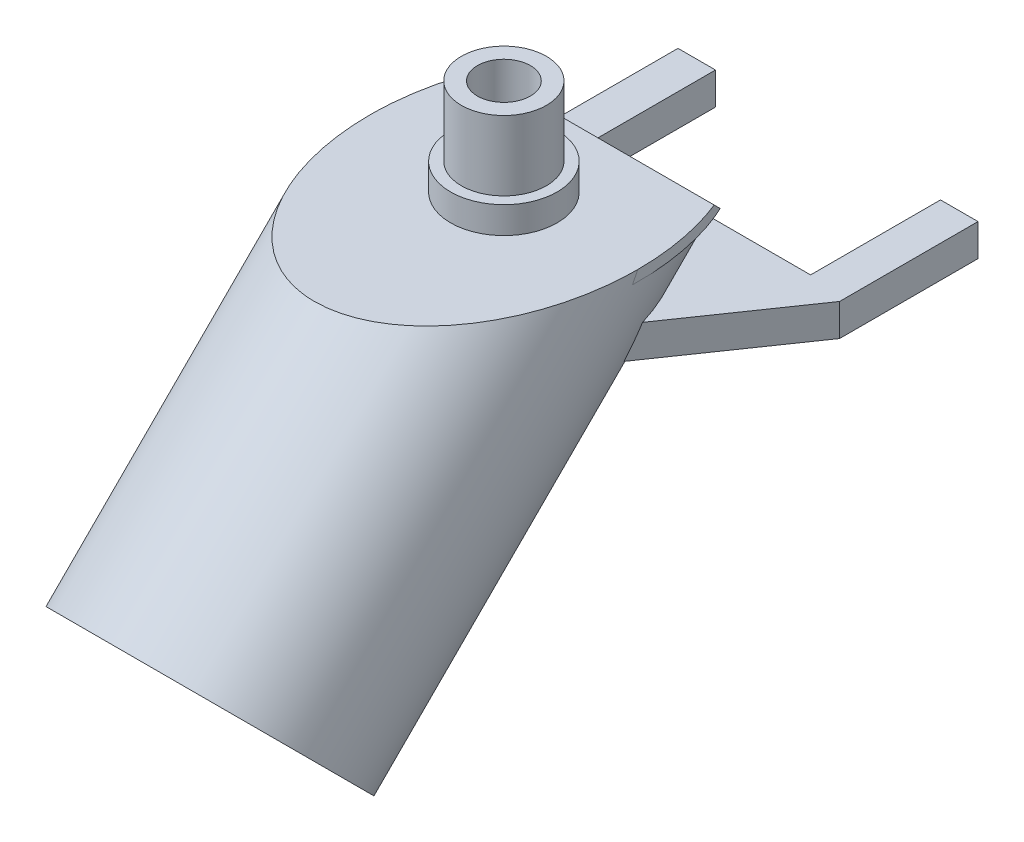
from build123d import *

# Parameters (mm, degrees)
SKETCH1_R                 = 9.94
SKETCH1_R_2               = 7.94
BOSS_EXTRUDE3_DEPTH       = 5
SKETCH1_6_R               = 7.94
SKETCH1_6_R_2             = 4.94
BOSS_EXTRUDE4_DEPTH       = 18
BOSS_EXTRUDE7_DEPTH       = 40
BOSS_EXTRUDE7_DEPTH_BACK  = 70
SKETCH4_R                 = 25
SKETCH4_R_2               = 23
SKETCH7_W                 = 197.712308018
SKETCH7_H                 = 113.854833504
CUT_EXTRUDE4_DEPTH        = 64
BOSS_EXTRUDE9_START       = -2
SKETCH9_RX                = 35.355339059
SKETCH9_RY                = 25
SKETCH9_R                 = 4.94
BOSS_EXTRUDE9_DEPTH       = 2
SKETCH13_W                = 94.503894001
SKETCH13_H                = 33.113273172
CUT_EXTRUDE7_DEPTH        = 32
BOSS_EXTRUDE11_START      = -2
BOSS_EXTRUDE11_DEPTH      = 2
BOSS_EXTRUDE12_DEPTH      = 2
BOSS_EXTRUDE12_DEPTH_BACK = 4


with BuildPart() as part:
    # Sketch1 → Boss-Extrude3 (new body)
    with BuildSketch(Plane(origin=(0, 0, 0), x_dir=(1, 0, 0), z_dir=(0, 1, 0))):
        with Locations(Location((0, 0, 0), (0, 0, 270))):
            Circle(SKETCH1_R)
        with Locations(Location((0, 0, 0), (0, 0, 270))):
            Circle(SKETCH1_R_2, mode=Mode.SUBTRACT)
    extrude(amount=BOSS_EXTRUDE3_DEPTH)

    # Sketch1<6> → Boss-Extrude4 (add)
    with BuildSketch(Plane(origin=(0, 0, 0), x_dir=(1, 0, 0), z_dir=(0, 1, 0))):
        with Locations(Location((0, 0, 0), (0, 0, 270))):
            Circle(SKETCH1_6_R)
        with Locations(Location((0, 0, 0), (0, 0, 270))):
            Circle(SKETCH1_6_R_2, mode=Mode.SUBTRACT)
    extrude(amount=BOSS_EXTRUDE4_DEPTH)



with BuildPart() as body_2:
    # Sketch4 → Boss-Extrude7 (new, two sides: drawn at the far end of the back side and taken through both)
    with BuildSketch(Plane(origin=(0, -5.365491749, 5.365491749), x_dir=(-1, 0, 0), z_dir=(0, 0.7071067811865458, -0.7071067811865492)).offset(-BOSS_EXTRUDE7_DEPTH_BACK)):
        with Locations(Location((0, 0, 0), (0, 0, 90))):
            Circle(SKETCH4_R)
        with Locations(Location((0, 0, 0), (0, 0, 90))):
            Circle(SKETCH4_R_2, mode=Mode.SUBTRACT)
    extrude(amount=BOSS_EXTRUDE7_DEPTH + BOSS_EXTRUDE7_DEPTH_BACK)

    # Sketch7 → Cut-Extrude4 (cut)
    with BuildSketch(Plane(origin=(0, 0, 0), x_dir=(1, 0, 0), z_dir=(0, 1, 0))):
        Rectangle(SKETCH7_W, SKETCH7_H)
    extrude(amount=CUT_EXTRUDE4_DEPTH, mode=Mode.SUBTRACT)


with BuildPart() as part_1:
    add(part.part)

    add(body_2.part)  # Boss-Extrude9 merges body 2
    # Sketch9 → Boss-Extrude9 (add)
    with BuildSketch(Plane(origin=(0, 0, 0), x_dir=(1, 0, 0), z_dir=(0, 1, 0)).offset(BOSS_EXTRUDE9_START)):
        with Locations(Location((0, 0), (0, 0, -90))):
            Ellipse(SKETCH9_RX, SKETCH9_RY)
        with Locations(Location((0, 0, 0), (0, 0, 270))):
            Circle(SKETCH9_R, mode=Mode.SUBTRACT)
    extrude(amount=BOSS_EXTRUDE9_DEPTH)

    # Sketch13 → Cut-Extrude7 (cut)
    with BuildSketch(Plane(origin=(0, 8.776643875, -8.776643875), x_dir=(-1, 0, 0), z_dir=(0, 0.7071067811865458, -0.7071067811865492))):
        with Locations((18.042265065, -27.160500048)):
            Rectangle(SKETCH13_W, SKETCH13_H)
    extrude(amount=CUT_EXTRUDE7_DEPTH, mode=Mode.SUBTRACT)

    # Boss-Extrude11: read off the stored shape, not the designer's step
    # Boss-Extrude11 outline → Boss-Extrude11 (add)
    with BuildSketch(Plane(origin=(0, 8.776643875, -8.776643875), x_dir=(-1, 0, 0), z_dir=(0, 0.7071067811865458, -0.7071067811865492)).offset(BOSS_EXTRUDE11_START)):
        with BuildLine():
            Line((18.806642372, -13.240475924), (-18.806642372, -13.240475924))
            ThreePointArc((-18.806642372, -13.240475924), (0, -23), (18.806642372, -13.240475924))
        make_face()
    extrude(amount=BOSS_EXTRUDE11_DEPTH)

    # Sketch15 → Boss-Extrude12 (add, two sides: drawn at the far end of the back side and taken through both)
    with BuildSketch(Plane(origin=(0, -13, 0), x_dir=(1, 0, 0), z_dir=(0, 1, 0)).offset(-BOSS_EXTRUDE12_DEPTH_BACK)):
        Polygon((-18, 50.5), (-18, 5.077623205), (-11, 12.425207431), (0.436295729, 16.20866498), (9.681434559, 13.33514052), (16.664877802, 7.136081647), (20.985766733, 0), (38, 24.667240496), (38, 50.5), (31, 50.5), (31, 26.250403727), (-11, 26.250403727), (-11, 50.5), align=None)
    extrude(amount=BOSS_EXTRUDE12_DEPTH + BOSS_EXTRUDE12_DEPTH_BACK)


solid = part_1.part
